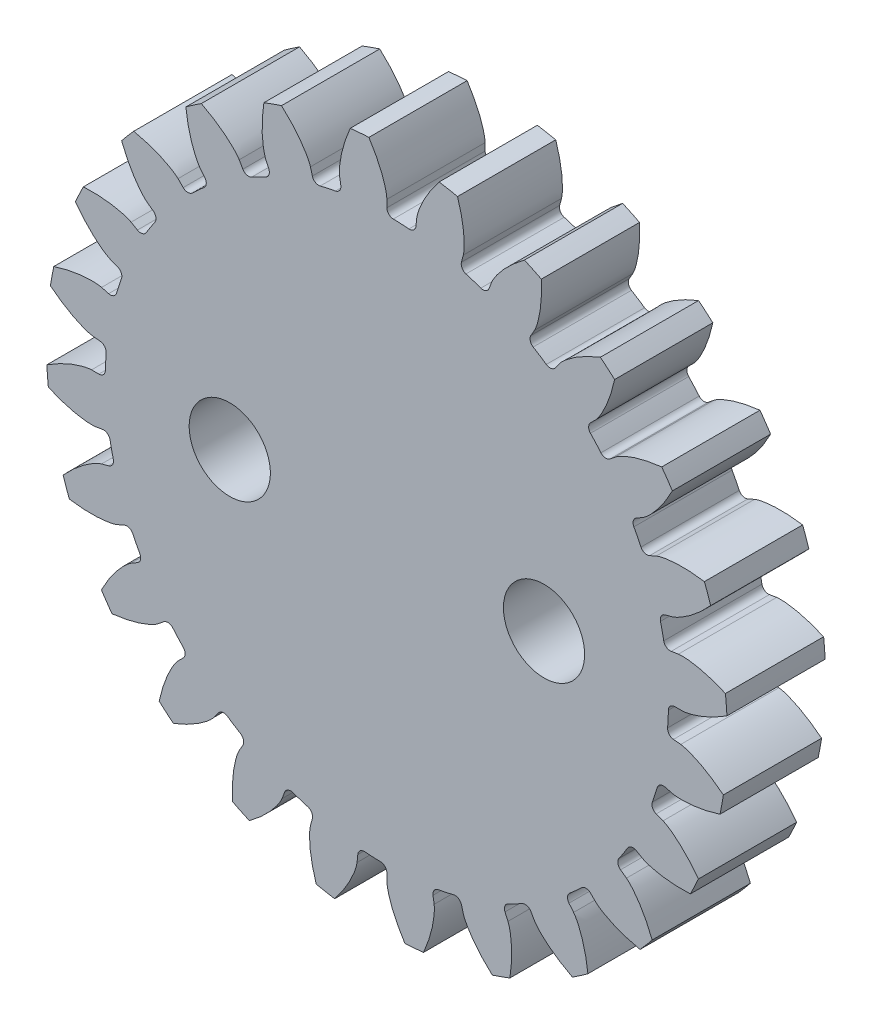
from build123d import *

# Parameters (mm, degrees)
SKETCH_3_R               = 26
EXTRUDE_2_DEPTH          = 7.5
CUT_EXTRUDE_2_DEPTH      = 38.526657192
PATTERN_CIRCULAR_1_COUNT = 24
MIRROR_1_COPY_1_DEPTH    = 38.526657192
MIRROR_1_COPY_2_DEPTH    = 38.526657192
MIRROR_1_COPY_3_DEPTH    = 38.526657192
MIRROR_1_COPY_4_DEPTH    = 38.526657192
MIRROR_1_COPY_5_DEPTH    = 38.526657192
MIRROR_1_COPY_6_DEPTH    = 38.526657192
MIRROR_1_COPY_7_DEPTH    = 38.526657192
MIRROR_1_COPY_8_DEPTH    = 38.526657192
MIRROR_1_COPY_9_DEPTH    = 38.526657192
MIRROR_1_COPY_10_DEPTH   = 38.526657192
MIRROR_1_COPY_11_DEPTH   = 38.526657192
MIRROR_1_COPY_12_DEPTH   = 38.526657192
MIRROR_1_COPY_13_DEPTH   = 38.526657192
MIRROR_1_COPY_14_DEPTH   = 38.526657192
MIRROR_1_COPY_15_DEPTH   = 38.526657192
MIRROR_1_COPY_16_DEPTH   = 38.526657192
MIRROR_1_COPY_17_DEPTH   = 38.526657192
MIRROR_1_COPY_18_DEPTH   = 38.526657192
MIRROR_1_COPY_19_DEPTH   = 38.526657192
MIRROR_1_COPY_20_DEPTH   = 38.526657192
MIRROR_1_COPY_21_DEPTH   = 38.526657192
MIRROR_1_COPY_22_DEPTH   = 38.526657192
MIRROR_1_COPY_23_DEPTH   = 38.526657192
MIRROR_1_COPY_24_DEPTH   = 38.526657192
FILLET_5_R               = 0.5
SKETCH_10_R              = 3.1
CUT_EXTRUDE_4_DEPTH      = 38.476388038


with BuildPart() as part:
    # ｽｹｯﾁ3 → ﾎﾞｽ - 押し出し2 (new body)
    with BuildSketch(Plane.XY):
        Circle(SKETCH_3_R)
    extrude(amount=EXTRUDE_2_DEPTH)

    # ｽｹｯﾁ4 → ｶｯﾄ - 押し出し2 (cut, through all)
    with BuildSketch(Plane.XY):
        with BuildLine():
            Line((21.472541613, -1.086258116), (25.966794508, -1.313614466))
            ThreePointArc((25.966794508, -1.313614466), (25.99998299, 0.029741003), (25.963721309, 1.373017029))
            add(Edge.make_bspline(
                [(22.552622899, 0), (22.58737922, 0.001108669), (22.656749084, 0.005403897), (22.850516265, 0.028314483), (23.215577821, 0.099947013), (23.763996392, 0.257632086), (24.493326716, 0.545763948), (25.148201555, 0.876714847), (25.627692166, 1.158881091), (25.900535651, 1.332190349), (25.963721309, 1.373017029)],
                knots=[0, 0, 0, 0, 0, 0.002802036, 0.005604071, 0.015718253, 0.029959921, 0.048733673, 0.068727069, 0.074791923, 0.074791923, 0.074791923, 0.074791923, 0.074791923], degree=4))
            Line((22.552622899, 0), (21.5, 0))
            ThreePointArc((21.5, 0), (21.493134307, -0.543302553), (21.472541613, -1.086258116))
        make_face()
    cut_extrude_2 = extrude(amount=CUT_EXTRUDE_2_DEPTH, mode=Mode.SUBTRACT)

    # 円形ﾊﾟﾀｰﾝ1: ｶｯﾄ - 押し出し2 ×24 about axis
    pattern_circular_1_axis = Axis((0, 0, 7.5), (0, 0, -1))
    for i in range(1, PATTERN_CIRCULAR_1_COUNT):
        add(cut_extrude_2.rotate(pattern_circular_1_axis, i * 360 / PATTERN_CIRCULAR_1_COUNT), mode=Mode.SUBTRACT)

    # ﾐﾗｰ1 copy 1 sketch → ﾐﾗｰ1 copy 1 (cut, through all)
    with BuildSketch(Plane(origin=(0, 0, 0), x_dir=(0.9871140654944314, 0.1600181917878578, 0), z_dir=(0, 0, 1))):
        with BuildLine():
            Line((21.472541613, 1.086258116), (25.966794508, 1.313614466))
            ThreePointArc((25.966794508, 1.313614466), (25.99998299, -0.029741003), (25.963721309, -1.373017029))
            add(Edge.make_bspline(
                [(22.552622899, 0), (22.58737922, -0.001108669), (22.656749084, -0.005403897), (22.850516265, -0.028314483), (23.215577821, -0.099947013), (23.763996392, -0.257632086), (24.493326716, -0.545763948), (25.148201555, -0.876714847), (25.627692166, -1.158881091), (25.900535651, -1.332190349), (25.963721309, -1.373017029)],
                knots=[0, 0, 0, 0, 0, 0.002802036, 0.005604071, 0.015718253, 0.029959921, 0.048733673, 0.068727069, 0.074791923, 0.074791923, 0.074791923, 0.074791923, 0.074791923], degree=4))
            Line((22.552622899, 0), (21.5, 0))
            ThreePointArc((21.5, 0), (21.493134307, 0.543302553), (21.472541613, 1.086258116))
        make_face()
    extrude(amount=MIRROR_1_COPY_1_DEPTH, mode=Mode.SUBTRACT)

    # ﾐﾗｰ1 copy 2 sketch → ﾐﾗｰ1 copy 2 (cut, through all)
    with BuildSketch(Plane(origin=(0, 0, 0), x_dir=(0.9120632137567047, 0.41004962396250505, 0), z_dir=(0, 0, 1))):
        with BuildLine():
            Line((21.472541613, 1.086258116), (25.966794508, 1.313614466))
            ThreePointArc((25.966794508, 1.313614466), (25.99998299, -0.029741003), (25.963721309, -1.373017029))
            add(Edge.make_bspline(
                [(22.552622899, 0), (22.58737922, -0.001108669), (22.656749084, -0.005403897), (22.850516265, -0.028314483), (23.215577821, -0.099947013), (23.763996392, -0.257632086), (24.493326716, -0.545763948), (25.148201555, -0.876714847), (25.627692166, -1.158881091), (25.900535651, -1.332190349), (25.963721309, -1.373017029)],
                knots=[0, 0, 0, 0, 0, 0.002802036, 0.005604071, 0.015718253, 0.029959921, 0.048733673, 0.068727069, 0.074791923, 0.074791923, 0.074791923, 0.074791923, 0.074791923], degree=4))
            Line((22.552622899, 0), (21.5, 0))
            ThreePointArc((21.5, 0), (21.493134307, 0.543302553), (21.472541613, 1.086258116))
        make_face()
    extrude(amount=MIRROR_1_COPY_2_DEPTH, mode=Mode.SUBTRACT)

    # ﾐﾗｰ1 copy 3 sketch → ﾐﾗｰ1 copy 3 (cut, through all)
    with BuildSketch(Plane(origin=(0, 0, 0), x_dir=(0.7748567612571848, 0.6321368519031512, 0), z_dir=(0, 0, 1))):
        with BuildLine():
            Line((21.472541613, 1.086258116), (25.966794508, 1.313614466))
            ThreePointArc((25.966794508, 1.313614466), (25.99998299, -0.029741003), (25.963721309, -1.373017029))
            add(Edge.make_bspline(
                [(22.552622899, 0), (22.58737922, -0.001108669), (22.656749084, -0.005403897), (22.850516265, -0.028314483), (23.215577821, -0.099947013), (23.763996392, -0.257632086), (24.493326716, -0.545763948), (25.148201555, -0.876714847), (25.627692166, -1.158881091), (25.900535651, -1.332190349), (25.963721309, -1.373017029)],
                knots=[0, 0, 0, 0, 0, 0.002802036, 0.005604071, 0.015718253, 0.029959921, 0.048733673, 0.068727069, 0.074791923, 0.074791923, 0.074791923, 0.074791923, 0.074791923], degree=4))
            Line((22.552622899, 0), (21.5, 0))
            ThreePointArc((21.5, 0), (21.493134307, 0.543302553), (21.472541613, 1.086258116))
        make_face()
    extrude(amount=MIRROR_1_COPY_3_DEPTH, mode=Mode.SUBTRACT)

    # ﾐﾗｰ1 copy 4 sketch → ﾐﾗｰ1 copy 4 (cut, through all)
    with BuildSketch(Plane(origin=(0, 0, 0), x_dir=(0.5848451009893306, 0.8111449980421381, 0), z_dir=(0, 0, 1))):
        with BuildLine():
            Line((21.472541613, 1.086258116), (25.966794508, 1.313614466))
            ThreePointArc((25.966794508, 1.313614466), (25.99998299, -0.029741003), (25.963721309, -1.373017029))
            add(Edge.make_bspline(
                [(22.552622899, 0), (22.58737922, -0.001108669), (22.656749084, -0.005403897), (22.850516265, -0.028314483), (23.215577821, -0.099947013), (23.763996392, -0.257632086), (24.493326716, -0.545763948), (25.148201555, -0.876714847), (25.627692166, -1.158881091), (25.900535651, -1.332190349), (25.963721309, -1.373017029)],
                knots=[0, 0, 0, 0, 0, 0.002802036, 0.005604071, 0.015718253, 0.029959921, 0.048733673, 0.068727069, 0.074791923, 0.074791923, 0.074791923, 0.074791923, 0.074791923], degree=4))
            Line((22.552622899, 0), (21.5, 0))
            ThreePointArc((21.5, 0), (21.493134307, 0.543302553), (21.472541613, 1.086258116))
        make_face()
    extrude(amount=MIRROR_1_COPY_4_DEPTH, mode=Mode.SUBTRACT)

    # ﾐﾗｰ1 copy 5 sketch → ﾐﾗｰ1 copy 5 (cut, through all)
    with BuildSketch(Plane(origin=(0, 0, 0), x_dir=(0.3549772135912804, 0.934874953045043, 0), z_dir=(0, 0, 1))):
        with BuildLine():
            Line((21.472541613, 1.086258116), (25.966794508, 1.313614466))
            ThreePointArc((25.966794508, 1.313614466), (25.99998299, -0.029741003), (25.963721309, -1.373017029))
            add(Edge.make_bspline(
                [(22.552622899, 0), (22.58737922, -0.001108669), (22.656749084, -0.005403897), (22.850516265, -0.028314483), (23.215577821, -0.099947013), (23.763996392, -0.257632086), (24.493326716, -0.545763948), (25.148201555, -0.876714847), (25.627692166, -1.158881091), (25.900535651, -1.332190349), (25.963721309, -1.373017029)],
                knots=[0, 0, 0, 0, 0, 0.002802036, 0.005604071, 0.015718253, 0.029959921, 0.048733673, 0.068727069, 0.074791923, 0.074791923, 0.074791923, 0.074791923, 0.074791923], degree=4))
            Line((22.552622899, 0), (21.5, 0))
            ThreePointArc((21.5, 0), (21.493134307, 0.543302553), (21.472541613, 1.086258116))
        make_face()
    extrude(amount=MIRROR_1_COPY_5_DEPTH, mode=Mode.SUBTRACT)

    # ﾐﾗｰ1 copy 6 sketch → ﾐﾗｰ1 copy 6 (cut, through all)
    with BuildSketch(Plane(origin=(0, 0, 0), x_dir=(0.10091821571456686, 0.9948947249518358, 0), z_dir=(0, 0, 1))):
        with BuildLine():
            Line((21.472541613, 1.086258116), (25.966794508, 1.313614466))
            ThreePointArc((25.966794508, 1.313614466), (25.99998299, -0.029741003), (25.963721309, -1.373017029))
            add(Edge.make_bspline(
                [(22.552622899, 0), (22.58737922, -0.001108669), (22.656749084, -0.005403897), (22.850516265, -0.028314483), (23.215577821, -0.099947013), (23.763996392, -0.257632086), (24.493326716, -0.545763948), (25.148201555, -0.876714847), (25.627692166, -1.158881091), (25.900535651, -1.332190349), (25.963721309, -1.373017029)],
                knots=[0, 0, 0, 0, 0, 0.002802036, 0.005604071, 0.015718253, 0.029959921, 0.048733673, 0.068727069, 0.074791923, 0.074791923, 0.074791923, 0.074791923, 0.074791923], degree=4))
            Line((22.552622899, 0), (21.5, 0))
            ThreePointArc((21.5, 0), (21.493134307, 0.543302553), (21.472541613, 1.086258116))
        make_face()
    extrude(amount=MIRROR_1_COPY_6_DEPTH, mode=Mode.SUBTRACT)

    # ﾐﾗｰ1 copy 7 sketch → ﾐﾗｰ1 copy 7 (cut, through all)
    with BuildSketch(Plane(origin=(0, 0, 0), x_dir=(-0.1600181917878578, 0.9871140654944318, 0), z_dir=(0, 0, 1))):
        with BuildLine():
            Line((21.472541613, 1.086258116), (25.966794508, 1.313614466))
            ThreePointArc((25.966794508, 1.313614466), (25.99998299, -0.029741003), (25.963721309, -1.373017029))
            add(Edge.make_bspline(
                [(22.552622899, 0), (22.58737922, -0.001108669), (22.656749084, -0.005403897), (22.850516265, -0.028314483), (23.215577821, -0.099947013), (23.763996392, -0.257632086), (24.493326716, -0.545763948), (25.148201555, -0.876714847), (25.627692166, -1.158881091), (25.900535651, -1.332190349), (25.963721309, -1.373017029)],
                knots=[0, 0, 0, 0, 0, 0.002802036, 0.005604071, 0.015718253, 0.029959921, 0.048733673, 0.068727069, 0.074791923, 0.074791923, 0.074791923, 0.074791923, 0.074791923], degree=4))
            Line((22.552622899, 0), (21.5, 0))
            ThreePointArc((21.5, 0), (21.493134307, 0.543302553), (21.472541613, 1.086258116))
        make_face()
    extrude(amount=MIRROR_1_COPY_7_DEPTH, mode=Mode.SUBTRACT)

    # ﾐﾗｰ1 copy 8 sketch → ﾐﾗｰ1 copy 8 (cut, through all)
    with BuildSketch(Plane(origin=(0, 0, 0), x_dir=(-0.41004962396250466, 0.9120632137567051, 0), z_dir=(0, 0, 1))):
        with BuildLine():
            Line((21.472541613, 1.086258116), (25.966794508, 1.313614466))
            ThreePointArc((25.966794508, 1.313614466), (25.99998299, -0.029741003), (25.963721309, -1.373017029))
            add(Edge.make_bspline(
                [(22.552622899, 0), (22.58737922, -0.001108669), (22.656749084, -0.005403897), (22.850516265, -0.028314483), (23.215577821, -0.099947013), (23.763996392, -0.257632086), (24.493326716, -0.545763948), (25.148201555, -0.876714847), (25.627692166, -1.158881091), (25.900535651, -1.332190349), (25.963721309, -1.373017029)],
                knots=[0, 0, 0, 0, 0, 0.002802036, 0.005604071, 0.015718253, 0.029959921, 0.048733673, 0.068727069, 0.074791923, 0.074791923, 0.074791923, 0.074791923, 0.074791923], degree=4))
            Line((22.552622899, 0), (21.5, 0))
            ThreePointArc((21.5, 0), (21.493134307, 0.543302553), (21.472541613, 1.086258116))
        make_face()
    extrude(amount=MIRROR_1_COPY_8_DEPTH, mode=Mode.SUBTRACT)

    # ﾐﾗｰ1 copy 9 sketch → ﾐﾗｰ1 copy 9 (cut, through all)
    with BuildSketch(Plane(origin=(0, 0, 0), x_dir=(-0.6321368519031508, 0.7748567612571852, 0), z_dir=(0, 0, 1))):
        with BuildLine():
            Line((21.472541613, 1.086258116), (25.966794508, 1.313614466))
            ThreePointArc((25.966794508, 1.313614466), (25.99998299, -0.029741003), (25.963721309, -1.373017029))
            add(Edge.make_bspline(
                [(22.552622899, 0), (22.58737922, -0.001108669), (22.656749084, -0.005403897), (22.850516265, -0.028314483), (23.215577821, -0.099947013), (23.763996392, -0.257632086), (24.493326716, -0.545763948), (25.148201555, -0.876714847), (25.627692166, -1.158881091), (25.900535651, -1.332190349), (25.963721309, -1.373017029)],
                knots=[0, 0, 0, 0, 0, 0.002802036, 0.005604071, 0.015718253, 0.029959921, 0.048733673, 0.068727069, 0.074791923, 0.074791923, 0.074791923, 0.074791923, 0.074791923], degree=4))
            Line((22.552622899, 0), (21.5, 0))
            ThreePointArc((21.5, 0), (21.493134307, 0.543302553), (21.472541613, 1.086258116))
        make_face()
    extrude(amount=MIRROR_1_COPY_9_DEPTH, mode=Mode.SUBTRACT)

    # ﾐﾗｰ1 copy 10 sketch → ﾐﾗｰ1 copy 10 (cut, through all)
    with BuildSketch(Plane(origin=(0, 0, 0), x_dir=(-0.811144998042138, 0.5848451009893306, 0), z_dir=(0, 0, 1))):
        with BuildLine():
            Line((21.472541613, 1.086258116), (25.966794508, 1.313614466))
            ThreePointArc((25.966794508, 1.313614466), (25.99998299, -0.029741003), (25.963721309, -1.373017029))
            add(Edge.make_bspline(
                [(22.552622899, 0), (22.58737922, -0.001108669), (22.656749084, -0.005403897), (22.850516265, -0.028314483), (23.215577821, -0.099947013), (23.763996392, -0.257632086), (24.493326716, -0.545763948), (25.148201555, -0.876714847), (25.627692166, -1.158881091), (25.900535651, -1.332190349), (25.963721309, -1.373017029)],
                knots=[0, 0, 0, 0, 0, 0.002802036, 0.005604071, 0.015718253, 0.029959921, 0.048733673, 0.068727069, 0.074791923, 0.074791923, 0.074791923, 0.074791923, 0.074791923], degree=4))
            Line((22.552622899, 0), (21.5, 0))
            ThreePointArc((21.5, 0), (21.493134307, 0.543302553), (21.472541613, 1.086258116))
        make_face()
    extrude(amount=MIRROR_1_COPY_10_DEPTH, mode=Mode.SUBTRACT)

    # ﾐﾗｰ1 copy 11 sketch → ﾐﾗｰ1 copy 11 (cut, through all)
    with BuildSketch(Plane(origin=(0, 0, 0), x_dir=(-0.9348749530450424, 0.3549772135912808, 0), z_dir=(0, 0, 1))):
        with BuildLine():
            Line((21.472541613, 1.086258116), (25.966794508, 1.313614466))
            ThreePointArc((25.966794508, 1.313614466), (25.99998299, -0.029741003), (25.963721309, -1.373017029))
            add(Edge.make_bspline(
                [(22.552622899, 0), (22.58737922, -0.001108669), (22.656749084, -0.005403897), (22.850516265, -0.028314483), (23.215577821, -0.099947013), (23.763996392, -0.257632086), (24.493326716, -0.545763948), (25.148201555, -0.876714847), (25.627692166, -1.158881091), (25.900535651, -1.332190349), (25.963721309, -1.373017029)],
                knots=[0, 0, 0, 0, 0, 0.002802036, 0.005604071, 0.015718253, 0.029959921, 0.048733673, 0.068727069, 0.074791923, 0.074791923, 0.074791923, 0.074791923, 0.074791923], degree=4))
            Line((22.552622899, 0), (21.5, 0))
            ThreePointArc((21.5, 0), (21.493134307, 0.543302553), (21.472541613, 1.086258116))
        make_face()
    extrude(amount=MIRROR_1_COPY_11_DEPTH, mode=Mode.SUBTRACT)

    # ﾐﾗｰ1 copy 12 sketch → ﾐﾗｰ1 copy 12 (cut, through all)
    with BuildSketch(Plane(origin=(0, 0, 0), x_dir=(-0.9948947249518354, 0.10091821571456693, 0), z_dir=(0, 0, 1))):
        with BuildLine():
            Line((21.472541613, 1.086258116), (25.966794508, 1.313614466))
            ThreePointArc((25.966794508, 1.313614466), (25.99998299, -0.029741003), (25.963721309, -1.373017029))
            add(Edge.make_bspline(
                [(22.552622899, 0), (22.58737922, -0.001108669), (22.656749084, -0.005403897), (22.850516265, -0.028314483), (23.215577821, -0.099947013), (23.763996392, -0.257632086), (24.493326716, -0.545763948), (25.148201555, -0.876714847), (25.627692166, -1.158881091), (25.900535651, -1.332190349), (25.963721309, -1.373017029)],
                knots=[0, 0, 0, 0, 0, 0.002802036, 0.005604071, 0.015718253, 0.029959921, 0.048733673, 0.068727069, 0.074791923, 0.074791923, 0.074791923, 0.074791923, 0.074791923], degree=4))
            Line((22.552622899, 0), (21.5, 0))
            ThreePointArc((21.5, 0), (21.493134307, 0.543302553), (21.472541613, 1.086258116))
        make_face()
    extrude(amount=MIRROR_1_COPY_12_DEPTH, mode=Mode.SUBTRACT)

    # ﾐﾗｰ1 copy 13 sketch → ﾐﾗｰ1 copy 13 (cut, through all)
    with BuildSketch(Plane(origin=(0, 0, 0), x_dir=(-0.9871140654944314, -0.16001819178785787, 0), z_dir=(0, 0, 1))):
        with BuildLine():
            Line((21.472541613, 1.086258116), (25.966794508, 1.313614466))
            ThreePointArc((25.966794508, 1.313614466), (25.99998299, -0.029741003), (25.963721309, -1.373017029))
            add(Edge.make_bspline(
                [(22.552622899, 0), (22.58737922, -0.001108669), (22.656749084, -0.005403897), (22.850516265, -0.028314483), (23.215577821, -0.099947013), (23.763996392, -0.257632086), (24.493326716, -0.545763948), (25.148201555, -0.876714847), (25.627692166, -1.158881091), (25.900535651, -1.332190349), (25.963721309, -1.373017029)],
                knots=[0, 0, 0, 0, 0, 0.002802036, 0.005604071, 0.015718253, 0.029959921, 0.048733673, 0.068727069, 0.074791923, 0.074791923, 0.074791923, 0.074791923, 0.074791923], degree=4))
            Line((22.552622899, 0), (21.5, 0))
            ThreePointArc((21.5, 0), (21.493134307, 0.543302553), (21.472541613, 1.086258116))
        make_face()
    extrude(amount=MIRROR_1_COPY_13_DEPTH, mode=Mode.SUBTRACT)

    # ﾐﾗｰ1 copy 14 sketch → ﾐﾗｰ1 copy 14 (cut, through all)
    with BuildSketch(Plane(origin=(0, 0, 0), x_dir=(-0.9120632137567046, -0.4100496239625052, 0), z_dir=(0, 0, 1))):
        with BuildLine():
            Line((21.472541613, 1.086258116), (25.966794508, 1.313614466))
            ThreePointArc((25.966794508, 1.313614466), (25.99998299, -0.029741003), (25.963721309, -1.373017029))
            add(Edge.make_bspline(
                [(22.552622899, 0), (22.58737922, -0.001108669), (22.656749084, -0.005403897), (22.850516265, -0.028314483), (23.215577821, -0.099947013), (23.763996392, -0.257632086), (24.493326716, -0.545763948), (25.148201555, -0.876714847), (25.627692166, -1.158881091), (25.900535651, -1.332190349), (25.963721309, -1.373017029)],
                knots=[0, 0, 0, 0, 0, 0.002802036, 0.005604071, 0.015718253, 0.029959921, 0.048733673, 0.068727069, 0.074791923, 0.074791923, 0.074791923, 0.074791923, 0.074791923], degree=4))
            Line((22.552622899, 0), (21.5, 0))
            ThreePointArc((21.5, 0), (21.493134307, 0.543302553), (21.472541613, 1.086258116))
        make_face()
    extrude(amount=MIRROR_1_COPY_14_DEPTH, mode=Mode.SUBTRACT)

    # ﾐﾗｰ1 copy 15 sketch → ﾐﾗｰ1 copy 15 (cut, through all)
    with BuildSketch(Plane(origin=(0, 0, 0), x_dir=(-0.774856761257185, -0.6321368519031512, 0), z_dir=(0, 0, 1))):
        with BuildLine():
            Line((21.472541613, 1.086258116), (25.966794508, 1.313614466))
            ThreePointArc((25.966794508, 1.313614466), (25.99998299, -0.029741003), (25.963721309, -1.373017029))
            add(Edge.make_bspline(
                [(22.552622899, 0), (22.58737922, -0.001108669), (22.656749084, -0.005403897), (22.850516265, -0.028314483), (23.215577821, -0.099947013), (23.763996392, -0.257632086), (24.493326716, -0.545763948), (25.148201555, -0.876714847), (25.627692166, -1.158881091), (25.900535651, -1.332190349), (25.963721309, -1.373017029)],
                knots=[0, 0, 0, 0, 0, 0.002802036, 0.005604071, 0.015718253, 0.029959921, 0.048733673, 0.068727069, 0.074791923, 0.074791923, 0.074791923, 0.074791923, 0.074791923], degree=4))
            Line((22.552622899, 0), (21.5, 0))
            ThreePointArc((21.5, 0), (21.493134307, 0.543302553), (21.472541613, 1.086258116))
        make_face()
    extrude(amount=MIRROR_1_COPY_15_DEPTH, mode=Mode.SUBTRACT)

    # ﾐﾗｰ1 copy 16 sketch → ﾐﾗｰ1 copy 16 (cut, through all)
    with BuildSketch(Plane(origin=(0, 0, 0), x_dir=(-0.584845100989331, -0.8111449980421379, 0), z_dir=(0, 0, 1))):
        with BuildLine():
            Line((21.472541613, 1.086258116), (25.966794508, 1.313614466))
            ThreePointArc((25.966794508, 1.313614466), (25.99998299, -0.029741003), (25.963721309, -1.373017029))
            add(Edge.make_bspline(
                [(22.552622899, 0), (22.58737922, -0.001108669), (22.656749084, -0.005403897), (22.850516265, -0.028314483), (23.215577821, -0.099947013), (23.763996392, -0.257632086), (24.493326716, -0.545763948), (25.148201555, -0.876714847), (25.627692166, -1.158881091), (25.900535651, -1.332190349), (25.963721309, -1.373017029)],
                knots=[0, 0, 0, 0, 0, 0.002802036, 0.005604071, 0.015718253, 0.029959921, 0.048733673, 0.068727069, 0.074791923, 0.074791923, 0.074791923, 0.074791923, 0.074791923], degree=4))
            Line((22.552622899, 0), (21.5, 0))
            ThreePointArc((21.5, 0), (21.493134307, 0.543302553), (21.472541613, 1.086258116))
        make_face()
    extrude(amount=MIRROR_1_COPY_16_DEPTH, mode=Mode.SUBTRACT)

    # ﾐﾗｰ1 copy 17 sketch → ﾐﾗｰ1 copy 17 (cut, through all)
    with BuildSketch(Plane(origin=(0, 0, 0), x_dir=(-0.3549772135912803, -0.934874953045043, 0), z_dir=(0, 0, 1))):
        with BuildLine():
            Line((21.472541613, 1.086258116), (25.966794508, 1.313614466))
            ThreePointArc((25.966794508, 1.313614466), (25.99998299, -0.029741003), (25.963721309, -1.373017029))
            add(Edge.make_bspline(
                [(22.552622899, 0), (22.58737922, -0.001108669), (22.656749084, -0.005403897), (22.850516265, -0.028314483), (23.215577821, -0.099947013), (23.763996392, -0.257632086), (24.493326716, -0.545763948), (25.148201555, -0.876714847), (25.627692166, -1.158881091), (25.900535651, -1.332190349), (25.963721309, -1.373017029)],
                knots=[0, 0, 0, 0, 0, 0.002802036, 0.005604071, 0.015718253, 0.029959921, 0.048733673, 0.068727069, 0.074791923, 0.074791923, 0.074791923, 0.074791923, 0.074791923], degree=4))
            Line((22.552622899, 0), (21.5, 0))
            ThreePointArc((21.5, 0), (21.493134307, 0.543302553), (21.472541613, 1.086258116))
        make_face()
    extrude(amount=MIRROR_1_COPY_17_DEPTH, mode=Mode.SUBTRACT)

    # ﾐﾗｰ1 copy 18 sketch → ﾐﾗｰ1 copy 18 (cut, through all)
    with BuildSketch(Plane(origin=(0, 0, 0), x_dir=(-0.10091821571456698, -0.9948947249518358, 0), z_dir=(0, 0, 1))):
        with BuildLine():
            Line((21.472541613, 1.086258116), (25.966794508, 1.313614466))
            ThreePointArc((25.966794508, 1.313614466), (25.99998299, -0.029741003), (25.963721309, -1.373017029))
            add(Edge.make_bspline(
                [(22.552622899, 0), (22.58737922, -0.001108669), (22.656749084, -0.005403897), (22.850516265, -0.028314483), (23.215577821, -0.099947013), (23.763996392, -0.257632086), (24.493326716, -0.545763948), (25.148201555, -0.876714847), (25.627692166, -1.158881091), (25.900535651, -1.332190349), (25.963721309, -1.373017029)],
                knots=[0, 0, 0, 0, 0, 0.002802036, 0.005604071, 0.015718253, 0.029959921, 0.048733673, 0.068727069, 0.074791923, 0.074791923, 0.074791923, 0.074791923, 0.074791923], degree=4))
            Line((22.552622899, 0), (21.5, 0))
            ThreePointArc((21.5, 0), (21.493134307, 0.543302553), (21.472541613, 1.086258116))
        make_face()
    extrude(amount=MIRROR_1_COPY_18_DEPTH, mode=Mode.SUBTRACT)

    # ﾐﾗｰ1 copy 19 sketch → ﾐﾗｰ1 copy 19 (cut, through all)
    with BuildSketch(Plane(origin=(0, 0, 0), x_dir=(0.16001819178785723, -0.9871140654944318, 0), z_dir=(0, 0, 1))):
        with BuildLine():
            Line((21.472541613, 1.086258116), (25.966794508, 1.313614466))
            ThreePointArc((25.966794508, 1.313614466), (25.99998299, -0.029741003), (25.963721309, -1.373017029))
            add(Edge.make_bspline(
                [(22.552622899, 0), (22.58737922, -0.001108669), (22.656749084, -0.005403897), (22.850516265, -0.028314483), (23.215577821, -0.099947013), (23.763996392, -0.257632086), (24.493326716, -0.545763948), (25.148201555, -0.876714847), (25.627692166, -1.158881091), (25.900535651, -1.332190349), (25.963721309, -1.373017029)],
                knots=[0, 0, 0, 0, 0, 0.002802036, 0.005604071, 0.015718253, 0.029959921, 0.048733673, 0.068727069, 0.074791923, 0.074791923, 0.074791923, 0.074791923, 0.074791923], degree=4))
            Line((22.552622899, 0), (21.5, 0))
            ThreePointArc((21.5, 0), (21.493134307, 0.543302553), (21.472541613, 1.086258116))
        make_face()
    extrude(amount=MIRROR_1_COPY_19_DEPTH, mode=Mode.SUBTRACT)

    # ﾐﾗｰ1 copy 20 sketch → ﾐﾗｰ1 copy 20 (cut, through all)
    with BuildSketch(Plane(origin=(0, 0, 0), x_dir=(0.410049623962505, -0.9120632137567051, 0), z_dir=(0, 0, 1))):
        with BuildLine():
            Line((21.472541613, 1.086258116), (25.966794508, 1.313614466))
            ThreePointArc((25.966794508, 1.313614466), (25.99998299, -0.029741003), (25.963721309, -1.373017029))
            add(Edge.make_bspline(
                [(22.552622899, 0), (22.58737922, -0.001108669), (22.656749084, -0.005403897), (22.850516265, -0.028314483), (23.215577821, -0.099947013), (23.763996392, -0.257632086), (24.493326716, -0.545763948), (25.148201555, -0.876714847), (25.627692166, -1.158881091), (25.900535651, -1.332190349), (25.963721309, -1.373017029)],
                knots=[0, 0, 0, 0, 0, 0.002802036, 0.005604071, 0.015718253, 0.029959921, 0.048733673, 0.068727069, 0.074791923, 0.074791923, 0.074791923, 0.074791923, 0.074791923], degree=4))
            Line((22.552622899, 0), (21.5, 0))
            ThreePointArc((21.5, 0), (21.493134307, 0.543302553), (21.472541613, 1.086258116))
        make_face()
    extrude(amount=MIRROR_1_COPY_20_DEPTH, mode=Mode.SUBTRACT)

    # ﾐﾗｰ1 copy 21 sketch → ﾐﾗｰ1 copy 21 (cut, through all)
    with BuildSketch(Plane(origin=(0, 0, 0), x_dir=(0.6321368519031507, -0.7748567612571853, 0), z_dir=(0, 0, 1))):
        with BuildLine():
            Line((21.472541613, 1.086258116), (25.966794508, 1.313614466))
            ThreePointArc((25.966794508, 1.313614466), (25.99998299, -0.029741003), (25.963721309, -1.373017029))
            add(Edge.make_bspline(
                [(22.552622899, 0), (22.58737922, -0.001108669), (22.656749084, -0.005403897), (22.850516265, -0.028314483), (23.215577821, -0.099947013), (23.763996392, -0.257632086), (24.493326716, -0.545763948), (25.148201555, -0.876714847), (25.627692166, -1.158881091), (25.900535651, -1.332190349), (25.963721309, -1.373017029)],
                knots=[0, 0, 0, 0, 0, 0.002802036, 0.005604071, 0.015718253, 0.029959921, 0.048733673, 0.068727069, 0.074791923, 0.074791923, 0.074791923, 0.074791923, 0.074791923], degree=4))
            Line((22.552622899, 0), (21.5, 0))
            ThreePointArc((21.5, 0), (21.493134307, 0.543302553), (21.472541613, 1.086258116))
        make_face()
    extrude(amount=MIRROR_1_COPY_21_DEPTH, mode=Mode.SUBTRACT)

    # ﾐﾗｰ1 copy 22 sketch → ﾐﾗｰ1 copy 22 (cut, through all)
    with BuildSketch(Plane(origin=(0, 0, 0), x_dir=(0.8111449980421376, -0.5848451009893312, 0), z_dir=(0, 0, 1))):
        with BuildLine():
            Line((21.472541613, 1.086258116), (25.966794508, 1.313614466))
            ThreePointArc((25.966794508, 1.313614466), (25.99998299, -0.029741003), (25.963721309, -1.373017029))
            add(Edge.make_bspline(
                [(22.552622899, 0), (22.58737922, -0.001108669), (22.656749084, -0.005403897), (22.850516265, -0.028314483), (23.215577821, -0.099947013), (23.763996392, -0.257632086), (24.493326716, -0.545763948), (25.148201555, -0.876714847), (25.627692166, -1.158881091), (25.900535651, -1.332190349), (25.963721309, -1.373017029)],
                knots=[0, 0, 0, 0, 0, 0.002802036, 0.005604071, 0.015718253, 0.029959921, 0.048733673, 0.068727069, 0.074791923, 0.074791923, 0.074791923, 0.074791923, 0.074791923], degree=4))
            Line((22.552622899, 0), (21.5, 0))
            ThreePointArc((21.5, 0), (21.493134307, 0.543302553), (21.472541613, 1.086258116))
        make_face()
    extrude(amount=MIRROR_1_COPY_22_DEPTH, mode=Mode.SUBTRACT)

    # ﾐﾗｰ1 copy 23 sketch → ﾐﾗｰ1 copy 23 (cut, through all)
    with BuildSketch(Plane(origin=(0, 0, 0), x_dir=(0.9348749530450425, -0.3549772135912805, 0), z_dir=(0, 0, 1))):
        with BuildLine():
            Line((21.472541613, 1.086258116), (25.966794508, 1.313614466))
            ThreePointArc((25.966794508, 1.313614466), (25.99998299, -0.029741003), (25.963721309, -1.373017029))
            add(Edge.make_bspline(
                [(22.552622899, 0), (22.58737922, -0.001108669), (22.656749084, -0.005403897), (22.850516265, -0.028314483), (23.215577821, -0.099947013), (23.763996392, -0.257632086), (24.493326716, -0.545763948), (25.148201555, -0.876714847), (25.627692166, -1.158881091), (25.900535651, -1.332190349), (25.963721309, -1.373017029)],
                knots=[0, 0, 0, 0, 0, 0.002802036, 0.005604071, 0.015718253, 0.029959921, 0.048733673, 0.068727069, 0.074791923, 0.074791923, 0.074791923, 0.074791923, 0.074791923], degree=4))
            Line((22.552622899, 0), (21.5, 0))
            ThreePointArc((21.5, 0), (21.493134307, 0.543302553), (21.472541613, 1.086258116))
        make_face()
    extrude(amount=MIRROR_1_COPY_23_DEPTH, mode=Mode.SUBTRACT)

    # ﾐﾗｰ1 copy 24 sketch → ﾐﾗｰ1 copy 24 (cut, through all)
    with BuildSketch(Plane(origin=(0, 0, 0), x_dir=(0.9948947249518354, -0.1009182157145668, 0), z_dir=(0, 0, 1))):
        with BuildLine():
            Line((21.472541613, 1.086258116), (25.966794508, 1.313614466))
            ThreePointArc((25.966794508, 1.313614466), (25.99998299, -0.029741003), (25.963721309, -1.373017029))
            add(Edge.make_bspline(
                [(22.552622899, 0), (22.58737922, -0.001108669), (22.656749084, -0.005403897), (22.850516265, -0.028314483), (23.215577821, -0.099947013), (23.763996392, -0.257632086), (24.493326716, -0.545763948), (25.148201555, -0.876714847), (25.627692166, -1.158881091), (25.900535651, -1.332190349), (25.963721309, -1.373017029)],
                knots=[0, 0, 0, 0, 0, 0.002802036, 0.005604071, 0.015718253, 0.029959921, 0.048733673, 0.068727069, 0.074791923, 0.074791923, 0.074791923, 0.074791923, 0.074791923], degree=4))
            Line((22.552622899, 0), (21.5, 0))
            ThreePointArc((21.5, 0), (21.493134307, 0.543302553), (21.472541613, 1.086258116))
        make_face()
    extrude(amount=MIRROR_1_COPY_24_DEPTH, mode=Mode.SUBTRACT)

    # ﾌｨﾚｯﾄ5
    fillet_5_edges = [part.edges().sort_by_distance(p)[0] for p in [
        (19.609359096, 8.816066915, 3.75),
        (18.619546181, 10.75, 3.75),
        (16.659420367, 13.590942316, 3.75),
        (15.202795796, 15.202795796, 3.75),
        (12.574169671, 17.439617458, 3.75),
        (10.75, 18.619546181, 3.75),
        (7.632010092, 20.09981149, 3.75),
        (5.56460947, 20.767405265, 3.75),
        (2.169741638, 21.390236586, 3.75),
        (0, 21.5, 3.75),
        (-3.440391123, 21.222952408, 3.75),
        (-5.56460947, 20.767405265, 3.75),
        (-8.816066915, 19.609359096, 3.75),
        (-10.75, 18.619546181, 3.75),
        (-13.590942316, 16.659420367, 3.75),
        (-15.202795796, 15.202795796, 3.75),
        (-17.439617458, 12.574169671, 3.75),
        (-18.619546181, 10.75, 3.75),
        (-20.09981149, 7.632010092, 3.75),
        (-20.767405265, 5.56460947, 3.75),
        (-21.390236586, 2.169741638, 3.75),
        (-21.5, 0, 3.75),
        (-21.222952408, -3.440391123, 3.75),
        (-20.767405265, -5.56460947, 3.75),
        (-19.609359096, -8.816066915, 3.75),
        (-18.619546181, -10.75, 3.75),
        (-16.659420367, -13.590942316, 3.75),
        (-15.202795796, -15.202795796, 3.75),
        (-12.574169671, -17.439617458, 3.75),
        (-10.75, -18.619546181, 3.75),
        (-7.632010092, -20.09981149, 3.75),
        (-5.56460947, -20.767405265, 3.75),
        (-2.169741638, -21.390236586, 3.75),
        (0, -21.5, 3.75),
        (3.440391123, -21.222952408, 3.75),
        (5.56460947, -20.767405265, 3.75),
        (8.816066915, -19.609359096, 3.75),
        (10.75, -18.619546181, 3.75),
        (13.590942316, -16.659420367, 3.75),
        (15.202795796, -15.202795796, 3.75),
        (17.439617458, -12.574169671, 3.75),
        (18.619546181, -10.75, 3.75),
        (20.09981149, -7.632010092, 3.75),
        (20.767405265, -5.56460947, 3.75),
        (21.390236586, -2.169741638, 3.75),
        (21.5, 0, 3.75),
        (21.222952408, 3.440391123, 3.75),
        (20.767405265, 5.56460947, 3.75),
    ]]
    fillet(fillet_5_edges, radius=FILLET_5_R)

    # ｽｹｯﾁ10 → ｶｯﾄ - 押し出し4 (cut, through all)
    with BuildSketch(Plane(origin=(0, 0, 0), x_dir=(-1, 0, 0), z_dir=(0, 0, -1))):
        with Locations((-12, 0)):
            Circle(SKETCH_10_R)
        with Locations((12, 0)):
            Circle(SKETCH_10_R)
    extrude(amount=-CUT_EXTRUDE_4_DEPTH, mode=Mode.SUBTRACT)


solid = part.part
